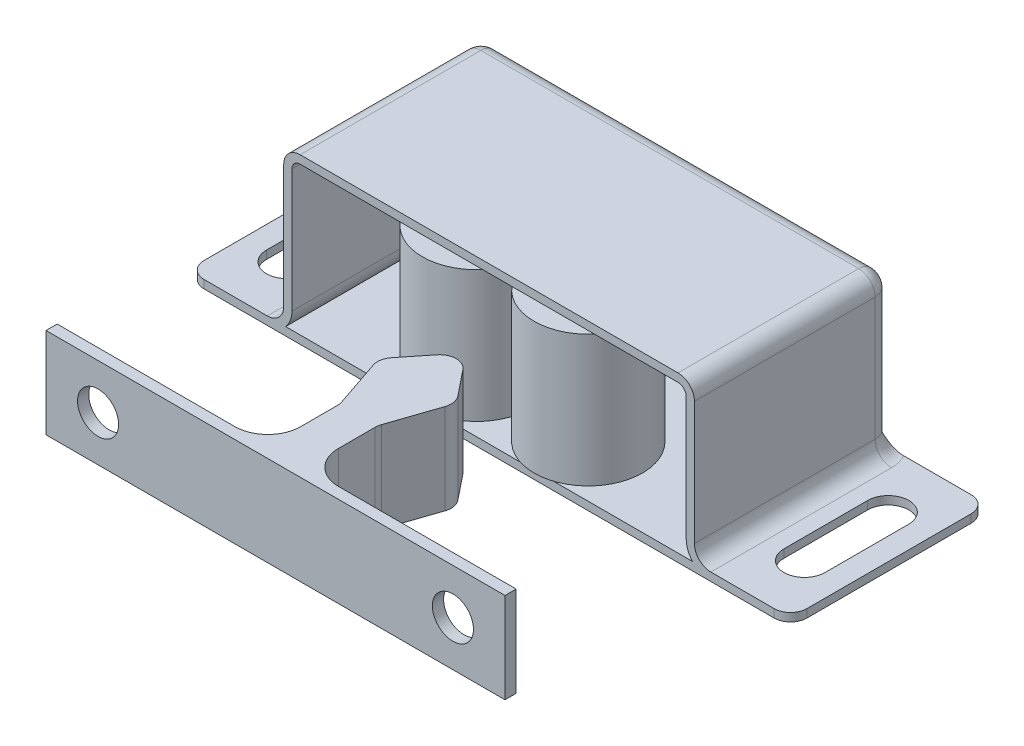
from build123d import *

# Parameters (mm, degrees)
BOSS_EXTRUDE1_DEPTH   = 15.24
FILLET1_R             = 1.27
FILLET3_R             = 1.27
FILLET2_R             = 1.27
CUT_EXTRUDE1_DEPTH    = 31.346689198
BOSS_EXTRUDE2_START   = -1.27
SKETCH4_R             = 4.191
BOSS_EXTRUDE2_DEPTH   = 10.16
BOSS_EXTRUDE2_2_DEPTH = 10.16
SHELL1_T              = -0.635
FILLET6_R             = 1.27
BOSS_EXTRUDE3_DEPTH   = 6.985
FILLET7_R             = 2.54
FILLET8_R             = 1.27
SKETCH6_R             = 1.5875
CUT_EXTRUDE2_DEPTH    = 40.945184743


with BuildPart() as part:
    # Sketch2 → Boss-Extrude1 (new body)
    with BuildSketch(Plane.XY):
        Polygon((15.875, -6.0325), (23.3045, -6.0325), (23.3045, -6.6675), (-23.3045, -6.6675), (-23.3045, -6.0325), (-15.875, -6.0325), (-15.875, 6.0325), (15.875, 6.0325), align=None)
    extrude(amount=BOSS_EXTRUDE1_DEPTH)

    # Fillet1
    fillet1_edges = [part.edges().sort_by_distance(p)[0] for p in [
        (-23.3045, -6.35, 15.24),
        (23.3045, -6.35, 15.24),
        (23.3045, -6.35, 0),
        (-23.3045, -6.35, 0),
    ]]
    fillet(fillet1_edges, radius=FILLET1_R)

    # Fillet3
    fillet3_edges = [part.edges().sort_by_distance(p)[0] for p in [
        (0, 6.0325, 0),
        (15.875, 0, 0),
        (-15.875, 6.0325, 7.62),
        (15.875, 6.0325, 7.62),
        (-15.875, 0, 0),
    ]]
    fillet(fillet3_edges, radius=FILLET3_R)

    # Fillet2
    # the kernel refuses this fillet: 1.27 mm, written as the material it adds along each edge
    with BuildSketch(Plane(origin=(15.875, -6.0325, 1.27), x_dir=(1, 0, 0), z_dir=(0, 0, 1)), Plane(origin=(-15.875, -6.0325, 1.27), x_dir=(0, 1, 0), z_dir=(0, 0, 1))) as fillet2_piece_1:
        with BuildLine():
            CenterArc((FILLET2_R, FILLET2_R), FILLET2_R, 180, 90)
            Line((0, FILLET2_R), (0, 0))
            Line((0, 0), (FILLET2_R, 0))
        make_face()
    extrude(amount=13.97)
    with BuildSketch(Plane(origin=(14.605, -6.0325, 1.27), x_dir=(-0.5976672776328289, 0, 0.8017442392976473), z_dir=(0.8017442392976473, 0, 0.5976672776328289))) as fillet2_piece_2_section:
        with BuildLine():
            CenterArc((1.27 + FILLET2_R, -FILLET2_R), FILLET2_R, 90, 90)
            Line((1.27, -FILLET2_R), (1.27, 0))
            Line((1.27, 0), (1.27 + FILLET2_R, 0))
        make_face()
    fillet2_piece_2 = revolve(axis=Axis((14.605, -6.0325, 1.27), (0, -1, 0)), revolution_arc=233.296989237, mode=Mode.PRIVATE)
    fillet2_piece_2 = split(fillet2_piece_2, bisect_by=Plane(origin=(15.557422349, -5.636731762, 0), z_dir=(0, 0, 1)), keep=Keep.TOP, mode=Mode.PRIVATE)
    add(fillet2_piece_2)
    with BuildSketch(Plane(origin=(-14.605, -6.0325, 1.27), x_dir=(0.5976672776328275, 0, 0.8017442392976483), z_dir=(-0.8017442392976483, 0, 0.5976672776328275))) as fillet2_piece_3_section:
        with BuildLine():
            CenterArc((1.27 + FILLET2_R, FILLET2_R), FILLET2_R, 180, 90)
            Line((1.27 + FILLET2_R, 0), (1.27, 0))
            Line((1.27, 0), (1.27, FILLET2_R))
        make_face()
    fillet2_piece_3 = revolve(axis=Axis((-14.605, -6.0325, 1.27), (0, 1, 0)), revolution_arc=233.296989237, mode=Mode.PRIVATE)
    fillet2_piece_3 = split(fillet2_piece_3, bisect_by=Plane(origin=(-15.557422462, -5.636732056, 0), z_dir=(0, 0, 1)), keep=Keep.TOP, mode=Mode.PRIVATE)
    add(fillet2_piece_3)

    # Sketch3 → Cut-Extrude1 (cut, through all)
    with BuildSketch(Plane(origin=(0, -6.0325, 0), x_dir=(1, 0, 0), z_dir=(0, 1, 0))):
        with BuildLine():
            Line((-18.415, -4.3815), (-18.415, -10.8585))
            ThreePointArc((-18.415, -10.8585), (-20.0025, -12.446), (-21.59, -10.8585))
            Line((-21.59, -10.8585), (-21.59, -4.3815))
            ThreePointArc((-21.59, -4.3815), (-20.0025, -2.794), (-18.415, -4.3815))
        make_face()
        with BuildLine():
            Line((21.59, -4.3815), (21.59, -10.8585))
            ThreePointArc((21.59, -10.8585), (20.0025, -12.446), (18.415, -10.8585))
            Line((18.415, -10.8585), (18.415, -4.3815))
            ThreePointArc((18.415, -4.3815), (20.0025, -2.794), (21.59, -4.3815))
        make_face()
    extrude(amount=-CUT_EXTRUDE1_DEPTH, mode=Mode.SUBTRACT)

    # Shell1
    shell1_openings = [part.faces().sort_by_distance(p)[0] for p in [
        (0, -0.451666987, 15.24),
    ]]
    offset(amount=SHELL1_T, openings=shell1_openings)

    # Fillet6
    fillet6_edges = [part.edges().sort_by_distance(p)[0] for p in [
        (0, -6.0325, 0.635),
    ]]
    fillet(fillet6_edges, radius=FILLET6_R)


with BuildPart() as body_2:
    # Sketch4 → Boss-Extrude2 (new body)
    with BuildSketch(Plane(origin=(0, 6.0325, 0), x_dir=(1, 0, 0), z_dir=(0, 1, 0)).offset(BOSS_EXTRUDE2_START)):
        with Locations(Location((-4.318, -11.8872, 0), (0, 0, 270))):
            Circle(SKETCH4_R)
    extrude(amount=-BOSS_EXTRUDE2_DEPTH)


with BuildPart() as body_3:
    # Sketch4 → Boss-Extrude2 2 (new body)
    with BuildSketch(Plane(origin=(0, 6.0325, 0), x_dir=(1, 0, 0), z_dir=(0, 1, 0)).offset(BOSS_EXTRUDE2_START)):
        with Locations(Location((4.318, -11.8872, 0), (0, 0, 270))):
            Circle(SKETCH4_R)
    extrude(amount=-BOSS_EXTRUDE2_2_DEPTH)


with BuildPart() as body_4:
    # Sketch5 → Boss-Extrude3 (new body)
    with BuildSketch(Plane(origin=(0, -6.0325, 0), x_dir=(1, 0, 0), z_dir=(0, 1, 0))):
        Polygon((-1.4605, -30.8864), (-1.4605, -25.2984), (-2.9972, -20.758354525), (0, -17.018), (2.9972, -20.758354525), (1.4605, -25.2984), (1.4605, -30.8864), (17.7419, -30.8864), (17.7419, -31.75), (-17.7419, -31.75), (-17.7419, -30.8864), align=None)
    extrude(amount=BOSS_EXTRUDE3_DEPTH)

    # Fillet7
    fillet7_edges = [body_4.edges().sort_by_distance(p)[0] for p in [
        (-1.4605, -2.54, 30.8864),
        (1.4605, -2.54, 30.8864),
    ]]
    fillet(fillet7_edges, radius=FILLET7_R)

    # Fillet8
    fillet8_edges = [body_4.edges().sort_by_distance(p)[0] for p in [
        (-1.4605, -2.54, 25.2984),
        (-2.9972, -2.54, 20.758354525),
        (0, -2.54, 17.018),
        (2.9972, -2.54, 20.758354525),
        (1.4605, -2.54, 25.2984),
    ]]
    fillet(fillet8_edges, radius=FILLET8_R)

    # Sketch6 → Cut-Extrude2 (cut, through all)
    with BuildSketch(Plane.XY.offset(31.75)):
        with Locations((-13.716, -2.54)):
            Circle(SKETCH6_R)
        with Locations((13.716, -2.54)):
            Circle(SKETCH6_R)
    extrude(amount=-CUT_EXTRUDE2_DEPTH, mode=Mode.SUBTRACT)


solid = Compound([part.part, body_2.part, body_3.part, body_4.part])
